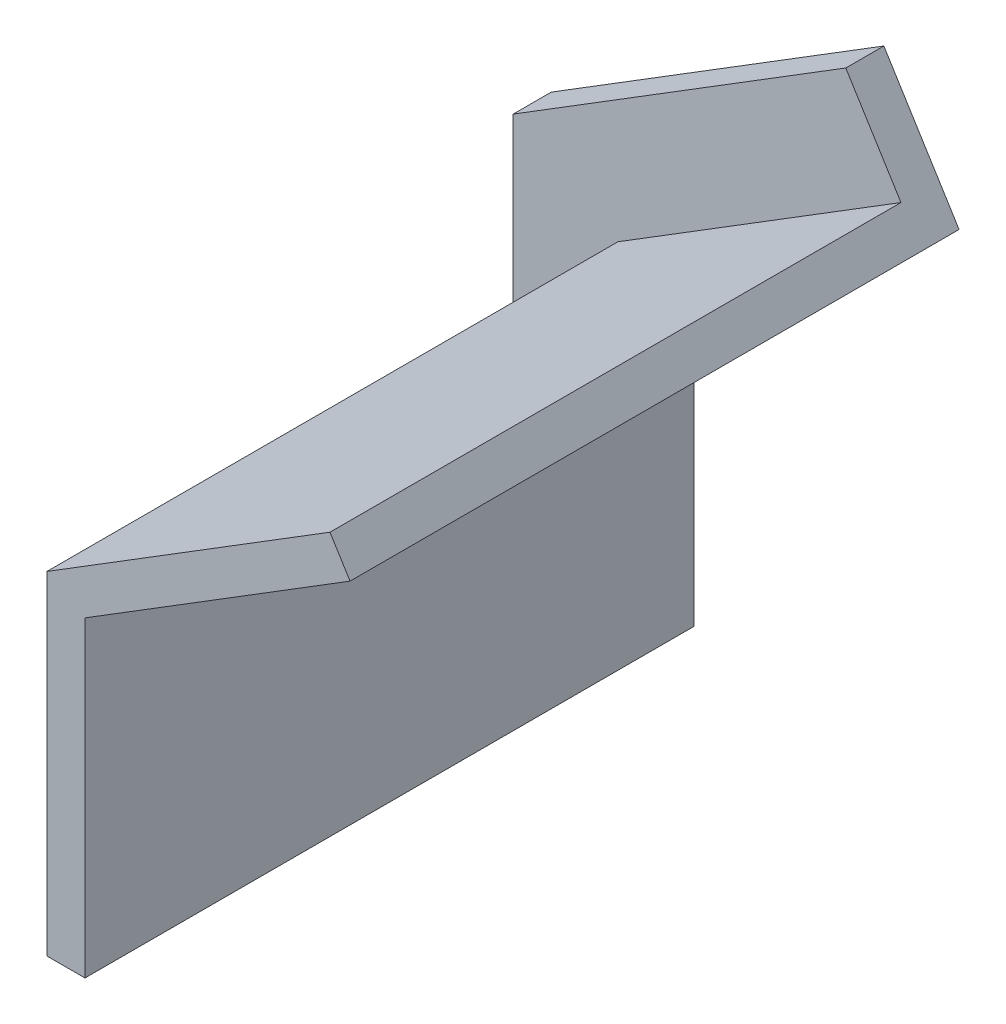
from build123d import *

# Parameters (mm, degrees)
BRKT_3_4_BOSS_EXTRUDE1_START = -60
BRKT_3_4_BOSS_EXTRUDE1_DEPTH = 120
BOSS_EXTRUDE1_DEPTH          = 8


# Read off the part's stored shape, not the designer's step: <BRKT_3_4>-<Boss-Extrude1>
with BuildPart() as part:
    # <BRKT_3_4>-<Boss-Extrude1> outline → <BRKT_3_4>-<Boss-Extrude1> (new body)
    with BuildSketch(Plane.XY.offset(BRKT_3_4_BOSS_EXTRUDE1_START)):
        Polygon((0, 0), (0, -70), (8, -70), (8, -4.452742878), (63.708134873, 30.087764141), (59.492488509, 36.886905685), align=None)
    extrude(amount=BRKT_3_4_BOSS_EXTRUDE1_DEPTH)

    # Sketch1 → Boss-Extrude1 (add)
    with BuildSketch(Plane(origin=(0, 0, -60), x_dir=(-1, 0, 0), z_dir=(0, 0, -1))):
        Polygon((-63.708134873, 30.087764141), (-47.899461008, 55.58454493), (22, 12.245042915), (22, -70), (0, -70), (-8, -70), (-8, -4.452742878), align=None)
    extrude(amount=BOSS_EXTRUDE1_DEPTH)


solid = part.part
